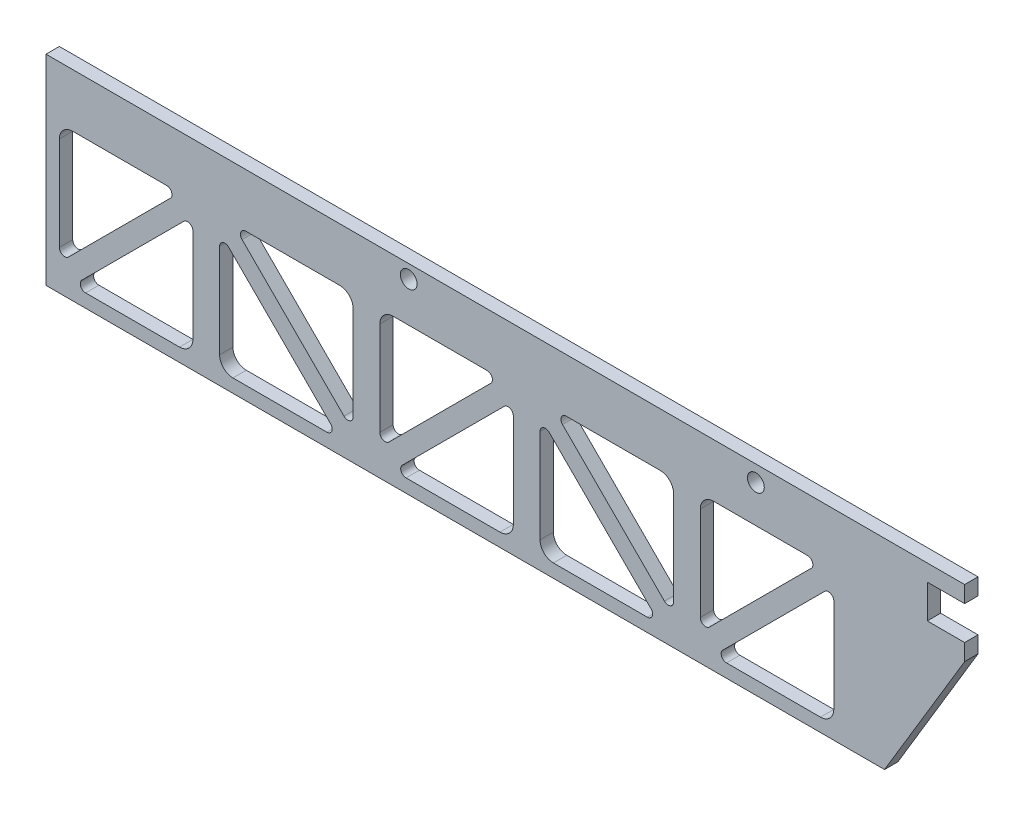
from build123d import *

# Parameters (mm, degrees)
MODEL_R             = 4
BOSS_EXTRUDE2_DEPTH = 6.35


with BuildPart() as part:
    # Model → Boss-Extrude2 (new body)
    with BuildSketch(Plane.XY):
        Polygon((419.1, 87.376), (419.1, 71.374), (436.88, 71.374), (436.88, 63.5), (398.78, 0), (0, 0), (0, 95.25), (436.88, 95.25), (436.88, 87.376), align=None)
        with Locations((172.491700482, 88.801347744)):
            Circle(MODEL_R, mode=Mode.SUBTRACT)
        with Locations((337.591700482, 87.63)):
            Circle(MODEL_R, mode=Mode.SUBTRACT)
        with BuildLine():
            Line((171.232102448, 6.35), (215.9, 6.35))
            ThreePointArc((215.9, 6.35), (220.390128061, 8.209871939), (222.25, 12.7))
            Line((222.25, 12.7), (222.25, 57.367897552))
            ThreePointArc((222.25, 57.367897552), (220.682015918, 59.714551565), (217.913948776, 59.163948776))
            Line((217.913948776, 59.163948776), (169.436051224, 10.686051224))
            ThreePointArc((169.436051224, 10.686051224), (168.885448435, 7.917984082), (171.232102448, 6.35))
        make_face(mode=Mode.SUBTRACT)
        with BuildLine():
            Line((234.95, 57.367897552), (234.95, 12.7))
            ThreePointArc((234.95, 12.7), (236.809871939, 8.209871939), (241.3, 6.35))
            Line((241.3, 6.35), (285.967897552, 6.35))
            ThreePointArc((285.967897552, 6.35), (288.314551565, 7.917984082), (287.763948776, 10.686051224))
            Line((287.763948776, 10.686051224), (239.286051224, 59.163948776))
            ThreePointArc((239.286051224, 59.163948776), (236.517984082, 59.714551565), (234.95, 57.367897552))
        make_face(mode=Mode.SUBTRACT)
        with BuildLine():
            Line((294.113948776, 17.036051224), (245.636051224, 65.513948776))
            ThreePointArc((245.636051224, 65.513948776), (245.085448435, 68.282015918), (247.432102448, 69.85))
            Line((247.432102448, 69.85), (292.1, 69.85))
            ThreePointArc((292.1, 69.85), (296.590128061, 67.990128061), (298.45, 63.5))
            Line((298.45, 63.5), (298.45, 18.832102448))
            ThreePointArc((298.45, 18.832102448), (296.882015918, 16.485448435), (294.113948776, 17.036051224))
        make_face(mode=Mode.SUBTRACT)
        with BuildLine():
            Line((323.632102448, 6.35), (368.3, 6.35))
            ThreePointArc((368.3, 6.35), (372.790128061, 8.209871939), (374.65, 12.7))
            Line((374.65, 12.7), (374.65, 57.367897552))
            ThreePointArc((374.65, 57.367897552), (373.082015918, 59.714551565), (370.313948776, 59.163948776))
            Line((370.313948776, 59.163948776), (321.836051224, 10.686051224))
            ThreePointArc((321.836051224, 10.686051224), (321.285448435, 7.917984082), (323.632102448, 6.35))
        make_face(mode=Mode.SUBTRACT)
        with BuildLine():
            Line((18.832102448, 6.35), (63.5, 6.35))
            ThreePointArc((63.5, 6.35), (67.990128061, 8.209871939), (69.85, 12.7))
            Line((69.85, 12.7), (69.85, 57.367897552))
            ThreePointArc((69.85, 57.367897552), (68.282015918, 59.714551565), (65.513948776, 59.163948776))
            Line((65.513948776, 59.163948776), (17.036051224, 10.686051224))
            ThreePointArc((17.036051224, 10.686051224), (16.485448435, 7.917984082), (18.832102448, 6.35))
        make_face(mode=Mode.SUBTRACT)
        with BuildLine():
            Line((82.55, 57.367897552), (82.55, 12.7))
            ThreePointArc((82.55, 12.7), (84.409871939, 8.209871939), (88.9, 6.35))
            Line((88.9, 6.35), (133.567897552, 6.35))
            ThreePointArc((133.567897552, 6.35), (135.914551565, 7.917984082), (135.363948776, 10.686051224))
            Line((135.363948776, 10.686051224), (86.886051224, 59.163948776))
            ThreePointArc((86.886051224, 59.163948776), (84.117984082, 59.714551565), (82.55, 57.367897552))
        make_face(mode=Mode.SUBTRACT)
        with BuildLine():
            Line((93.236051224, 65.513948776), (141.713948776, 17.036051224))
            ThreePointArc((141.713948776, 17.036051224), (144.482015918, 16.485448435), (146.05, 18.832102448))
            Line((146.05, 18.832102448), (146.05, 63.5))
            ThreePointArc((146.05, 63.5), (144.190128061, 67.990128061), (139.7, 69.85))
            Line((139.7, 69.85), (95.032102448, 69.85))
            ThreePointArc((95.032102448, 69.85), (92.685448435, 68.282015918), (93.236051224, 65.513948776))
        make_face(mode=Mode.SUBTRACT)
        with BuildLine():
            Line((163.086051224, 17.036051224), (211.563948776, 65.513948776))
            ThreePointArc((211.563948776, 65.513948776), (212.114551565, 68.282015918), (209.767897552, 69.85))
            Line((209.767897552, 69.85), (165.1, 69.85))
            ThreePointArc((165.1, 69.85), (160.609871939, 67.990128061), (158.75, 63.5))
            Line((158.75, 63.5), (158.75, 18.832102448))
            ThreePointArc((158.75, 18.832102448), (160.317984082, 16.485448435), (163.086051224, 17.036051224))
        make_face(mode=Mode.SUBTRACT)
        with BuildLine():
            Line((315.486051224, 17.036051224), (363.963948776, 65.513948776))
            ThreePointArc((363.963948776, 65.513948776), (364.514551565, 68.282015918), (362.167897552, 69.85))
            Line((362.167897552, 69.85), (317.5, 69.85))
            ThreePointArc((317.5, 69.85), (313.009871939, 67.990128061), (311.15, 63.5))
            Line((311.15, 63.5), (311.15, 18.832102448))
            ThreePointArc((311.15, 18.832102448), (312.717984082, 16.485448435), (315.486051224, 17.036051224))
        make_face(mode=Mode.SUBTRACT)
        with BuildLine():
            Line((6.35, 63.5), (6.35, 18.832102448))
            ThreePointArc((6.35, 18.832102448), (7.917984082, 16.485448435), (10.686051224, 17.036051224))
            Line((10.686051224, 17.036051224), (59.163948776, 65.513948776))
            ThreePointArc((59.163948776, 65.513948776), (59.714551565, 68.282015918), (57.367897552, 69.85))
            Line((57.367897552, 69.85), (12.7, 69.85))
            ThreePointArc((12.7, 69.85), (8.209871939, 67.990128061), (6.35, 63.5))
        make_face(mode=Mode.SUBTRACT)
    extrude(amount=BOSS_EXTRUDE2_DEPTH)


solid = part.part
